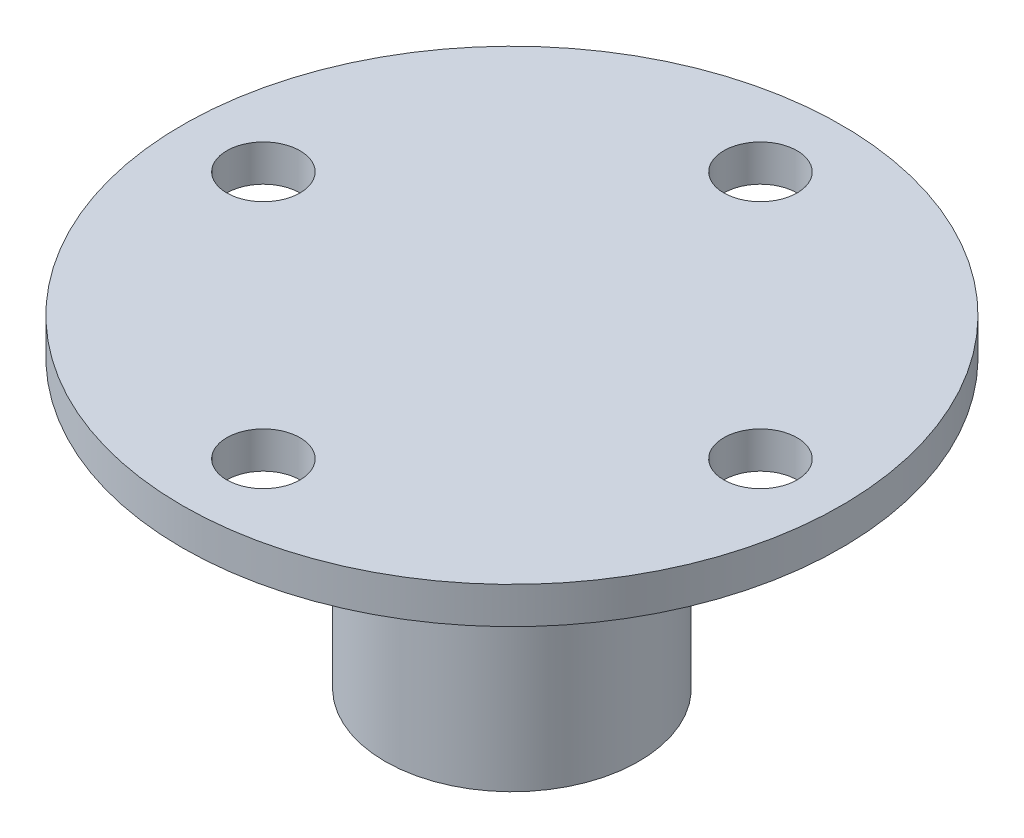
from build123d import *

# Parameters (mm, degrees)
SKETCH1_R           = 28.575
SKETCH1_R_2         = 3.175
SKETCH1_R_3         = 11
BOSS_EXTRUDE1_DEPTH = 3.175
SKETCH1_4_R         = 11
BOSS_EXTRUDE2_DEPTH = 3.175
SKETCH1_5_R         = 11
BOSS_EXTRUDE3_DEPTH = 24.825


with BuildPart() as part:
    # Sketch1 → Boss-Extrude1 (new body)
    with BuildSketch(Plane(origin=(0, 0, 0), x_dir=(1, 0, 0), z_dir=(0, 1, 0))):
        Circle(SKETCH1_R)
        with Locations((0, -21.548)):
            Circle(SKETCH1_R_2, mode=Mode.SUBTRACT)
        with Locations((-21.548, 0)):
            Circle(SKETCH1_R_2, mode=Mode.SUBTRACT)
        Circle(SKETCH1_R_3, mode=Mode.SUBTRACT)
        with BuildLine():
            ThreePointArc((24.723, 0), (21.548, -3.175), (18.373, 0))
            ThreePointArc((18.373, 0), (21.548, 3.175), (24.723, 0))
        make_face(mode=Mode.SUBTRACT)
        with Locations((0, 21.548)):
            Circle(SKETCH1_R_2, mode=Mode.SUBTRACT)
    extrude(amount=BOSS_EXTRUDE1_DEPTH)

    # Sketch1<4> → Boss-Extrude2 (add)
    with BuildSketch(Plane(origin=(0, 0, 0), x_dir=(1, 0, 0), z_dir=(0, 1, 0))):
        Circle(SKETCH1_4_R)
    extrude(amount=BOSS_EXTRUDE2_DEPTH)

    # Sketch1<5> → Boss-Extrude3 (add)
    with BuildSketch(Plane(origin=(0, 0, 0), x_dir=(1, 0, 0), z_dir=(0, 1, 0))):
        Circle(SKETCH1_5_R)
        with BuildLine():
            ThreePointArc((-5.414213562, -2.585786438), (-1.325654296, 5.851721173), (6, 0))
            ThreePointArc((6, 0), (3.200412581, -5.075170865), (-2.585786438, -5.414213562))
            Line((-2.585786438, -5.414213562), (-3.889087297, -6.717514421))
            Line((-3.889087297, -6.717514421), (-6.717514421, -3.889087297))
            Line((-6.717514421, -3.889087297), (-5.414213562, -2.585786438))
        make_face(mode=Mode.SUBTRACT)
    extrude(amount=-BOSS_EXTRUDE3_DEPTH)


solid = part.part
